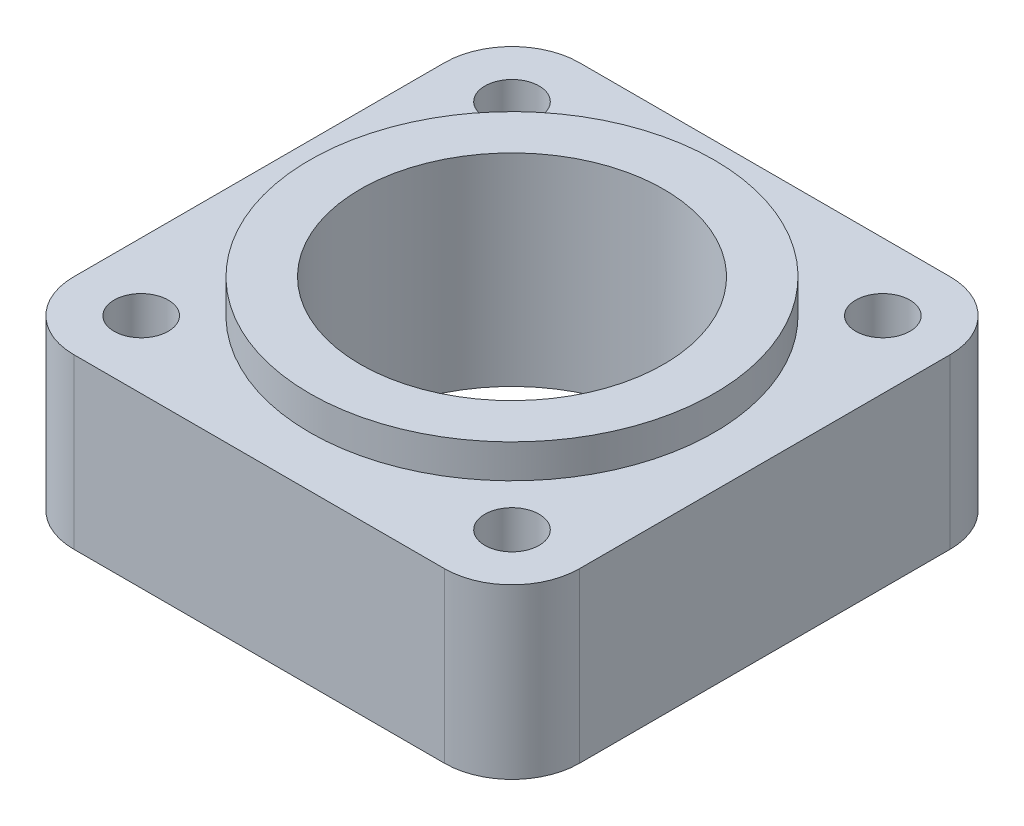
from build123d import *

# Parameters (mm, degrees)
SKETCH1_W               = 47.625
SKETCH1_H               = 47.625
BOSS_EXTRUDE1_DEPTH     = 15.875
SKETCH2_R               = 19.05
BOSS_EXTRUDE2_DEPTH     = 3.175
SKETCH3_R               = 14.2875
CUT_EXTRUDE1_DEPTH      = 39.690732902
F_1_4_20_TAPPED_HOLE1_D = 5.1054
FILLET1_R               = 6.35


with BuildPart() as part:
    # Sketch1 → Boss-Extrude1 (new body)
    with BuildSketch(Plane(origin=(0, 0, 0), x_dir=(1, 0, 0), z_dir=(0, 1, 0))):
        Rectangle(SKETCH1_W, SKETCH1_H)
    extrude(amount=BOSS_EXTRUDE1_DEPTH)

    # Sketch2 → Boss-Extrude2 (add)
    with BuildSketch(Plane(origin=(0, 15.875, 0), x_dir=(1, 0, 0), z_dir=(0, 1, 0))):
        Circle(SKETCH2_R)
    extrude(amount=BOSS_EXTRUDE2_DEPTH)

    # Sketch3 → Cut-Extrude1 (cut, through all)
    with BuildSketch(Plane(origin=(0, 19.05, 0), x_dir=(1, 0, 0), z_dir=(0, 1, 0))):
        Circle(SKETCH3_R)
    extrude(amount=-CUT_EXTRUDE1_DEPTH, mode=Mode.SUBTRACT)

    # 1/4-20 Tapped Hole1 (through all)
    with Locations(Plane(origin=(0, 15.875, 0), x_dir=(1, 0, 0), z_dir=(0, 1, 0))):
        with Locations((-17.4625, 17.4625), (17.4625, 17.4625), (17.4625, -17.4625), (-17.4625, -17.4625)):
            Hole(F_1_4_20_TAPPED_HOLE1_D / 2)

    # Fillet1
    fillet1_edges = [part.edges().sort_by_distance(p)[0] for p in [
        (-23.8125, 7.9375, -23.8125),
        (23.8125, 7.9375, -23.8125),
        (-23.8125, 7.9375, 23.8125),
        (23.8125, 7.9375, 23.8125),
    ]]
    fillet(fillet1_edges, radius=FILLET1_R)


solid = part.part
